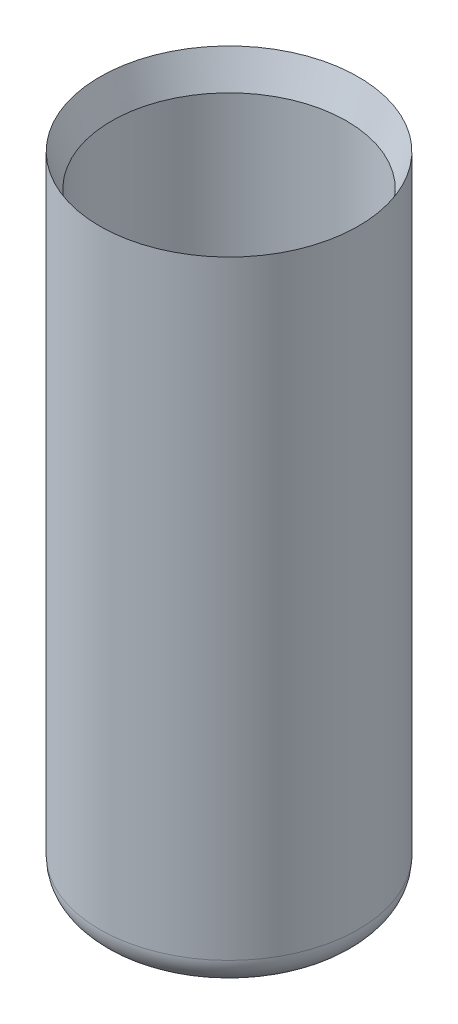
from build123d import *

# Parameters (mm, degrees)
SKETCH1_R           = 22
SKETCH1_R_2         = 20
BOSS_EXTRUDE1_DEPTH = 10
BOSS_EXTRUDE2_START = 100
SKETCH1_3_R         = 22
SKETCH1_3_R_2       = 20
BOSS_EXTRUDE2_DEPTH = 100
FILLET1_R           = 5
FILLET2_R           = 5
BOSS_EXTRUDE3_DEPTH = 2
CHAMFER1_SIZE       = 2.5
CHAMFER1_SIZE_2     = 6.868693549


with BuildPart() as part:
    # Sketch1 → Boss-Extrude1 (new body)
    # profile 1 of 2: a face of its own
    with BuildSketch(Plane(origin=(0, 0, 0), x_dir=(1, 0, 0), z_dir=(0, 1, 0))):
        with Locations(Location((0, 0, 0), (0, 0, 270))):
            Circle(SKETCH1_R)
        Circle(SKETCH1_R_2, mode=Mode.SUBTRACT)
    # profile 2 of 2: a face of its own
    with BuildSketch(Plane(origin=(0, 0, 0), x_dir=(1, 0, 0), z_dir=(0, 1, 0))):
        Circle(SKETCH1_R_2)
    extrude(amount=-BOSS_EXTRUDE1_DEPTH)

    # Sketch1<3> → Boss-Extrude2 (add)
    with BuildSketch(Plane(origin=(0, 0, 0), x_dir=(1, 0, 0), z_dir=(0, 1, 0)).offset(BOSS_EXTRUDE2_START)):
        with Locations(Location((0, 0, 0), (0, 0, 270))):
            Circle(SKETCH1_3_R)
        with Locations(Location((0, 0, 0), (0, 0, 270))):
            Circle(SKETCH1_3_R_2, mode=Mode.SUBTRACT)
    extrude(amount=-BOSS_EXTRUDE2_DEPTH)

    # Fillet1
    fillet1_edges = [part.edges().sort_by_distance(p)[0] for p in [
        (0, 0, -20),
    ]]
    fillet(fillet1_edges, radius=FILLET1_R)

    # Fillet2
    fillet2_edges = [part.edges().sort_by_distance(p)[0] for p in [
        (0, -10, -22),
    ]]
    fillet(fillet2_edges, radius=FILLET2_R)

    # Sketch2 → Boss-Extrude3 (add)
    with BuildSketch(Plane.XZ.offset(10)):
        with BuildLine():
            ThreePointArc((2.165063509, 10.75), (0, 12), (-2.165063509, 10.75))
            Line((-2.165063509, 10.75), (-2.5, 10.169872981))
            Line((-2.5, 10.169872981), (-2.5, 0))
            ThreePointArc((-2.5, 0), (0, -2.5), (2.5, 0))
            Line((2.5, 0), (2.5, 10.169872981))
            Line((2.5, 10.169872981), (2.165063509, 10.75))
        make_face()
        with BuildLine():
            ThreePointArc((-2.165063509, -4.75), (-2.5, -6), (-2.165063509, -7.25))
            Line((-2.165063509, -7.25), (2.165063509, -7.25))
            ThreePointArc((2.165063509, -7.25), (2.5, -6), (2.165063509, -4.75))
            Line((2.165063509, -4.75), (-2.165063509, -4.75))
        make_face()
    extrude(amount=BOSS_EXTRUDE3_DEPTH)

    # Chamfer1
    # the kernel refuses this chamfer: 6.868693549, 2.5 mm, written as the material it takes off along each edge
    with BuildSketch(Plane(origin=(0, 100, 0), x_dir=(0, 0, 1), z_dir=(-1, 0, 0))) as chamfer1_piece_1:
        Polygon((20 + CHAMFER1_SIZE, 0), (20, -CHAMFER1_SIZE_2), (20, 0), align=None)
    revolve(axis=Axis((0, 100, 0), (0, 1, 0)), mode=Mode.SUBTRACT)


solid = part.part
